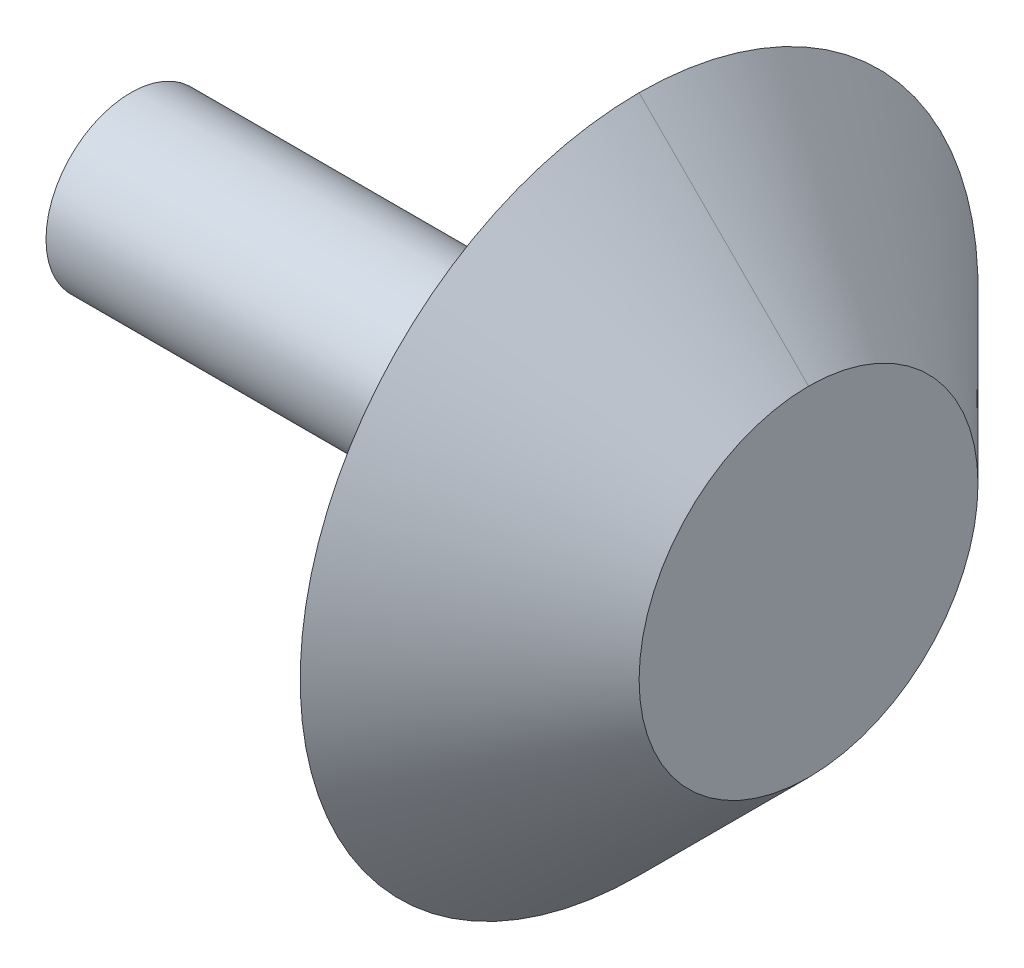
from build123d import *


with BuildPart() as part:
    # Sketch1 → Base-Revolve (revolve)
    with BuildSketch(Plane.XY):
        Polygon((0, 0), (0, 9.525), (57.15, 9.525), (57.15, 38.1), (76.2, 19.05), (76.2, 0), align=None)
    revolve(axis=Axis((0, 0, 0), (1, 0, 0)))


solid = part.part
